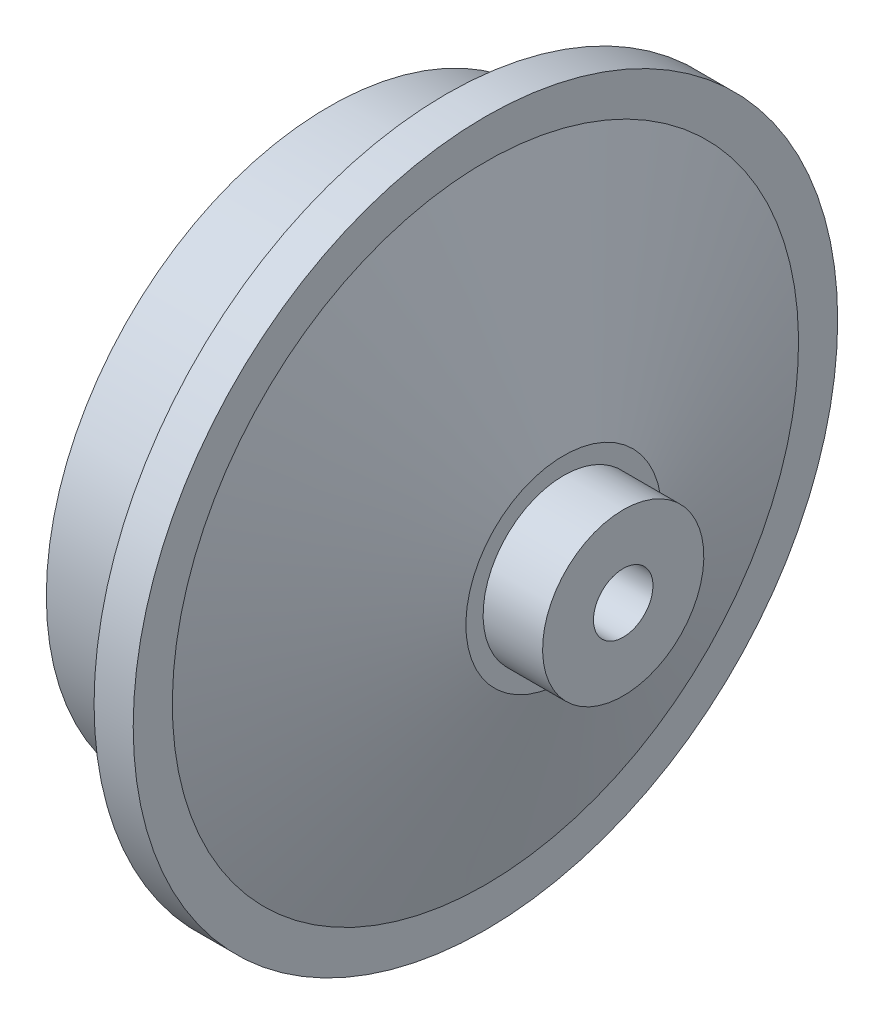
from build123d import *

# Parameters (mm, degrees)
SKETCH1_R           = 57.15
BOSS_EXTRUDE1_DEPTH = 6.35
SKETCH2_R           = 45.847
BOSS_EXTRUDE2_DEPTH = 19.05
SKETCH3_R           = 38.227
CUT_EXTRUDE1_DEPTH  = 6.604
SKETCH6_R           = 13.081
BOSS_EXTRUDE3_DEPTH = 9.652
SKETCH7_R           = 4.826
CUT_EXTRUDE2_DEPTH  = 94.87490881
FILLET1_R           = 2.032


with BuildPart() as part:
    # Sketch1 → Boss-Extrude1 (new body)
    with BuildSketch(Plane(origin=(0, 0, 0), x_dir=(0, 0, -1), z_dir=(1, 0, 0))):
        Circle(SKETCH1_R)
    extrude(amount=BOSS_EXTRUDE1_DEPTH)

    # Sketch2 → Boss-Extrude2 (add)
    with BuildSketch(Plane.ZY):
        Circle(SKETCH2_R)
    extrude(amount=BOSS_EXTRUDE2_DEPTH)

    # Sketch3 → Cut-Extrude1 (cut)
    with BuildSketch(Plane.ZY.offset(19.05)):
        Circle(SKETCH3_R)
    extrude(amount=-CUT_EXTRUDE1_DEPTH, mode=Mode.SUBTRACT)

    # Sketch5 → Revolve1 (revolve)
    with BuildSketch(Plane.XY):
        Polygon((6.35, -50.8), (19.05, -15.875), (19.05, 0), (6.35, 0), align=None)
    revolve(axis=Axis((6.35, 0, 0), (1, 0, 0)))

    # Sketch6 → Boss-Extrude3 (add)
    with BuildSketch(Plane(origin=(19.05, 0, 0), x_dir=(0, 0, -1), z_dir=(1, 0, 0))):
        Circle(SKETCH6_R)
    extrude(amount=BOSS_EXTRUDE3_DEPTH)

    # Sketch7 → Cut-Extrude2 (cut, through all)
    with BuildSketch(Plane(origin=(28.702, 0, 0), x_dir=(0, 0, -1), z_dir=(1, 0, 0))):
        Circle(SKETCH7_R)
    extrude(amount=-CUT_EXTRUDE2_DEPTH, mode=Mode.SUBTRACT)

    # Sketch8 → Cut-Revolve2 (revolve, cut)
    with BuildSketch(Plane.XY):
        Polygon((0, 0), (-12.446, 0), (-12.446, -29.21), (-2.794, -29.21), (10.414, -15.875), (10.414, 0), align=None)
    revolve(axis=Axis((10.414, 0, 0), (-1, 0, 0)), mode=Mode.SUBTRACT)

    # Fillet1
    fillet1_edges = [part.edges().sort_by_distance(p)[0] for p in [
        (-2.794, 29.21, 0),
        (10.414, 15.875, 0),
    ]]
    fillet(fillet1_edges, radius=FILLET1_R)


solid = part.part
